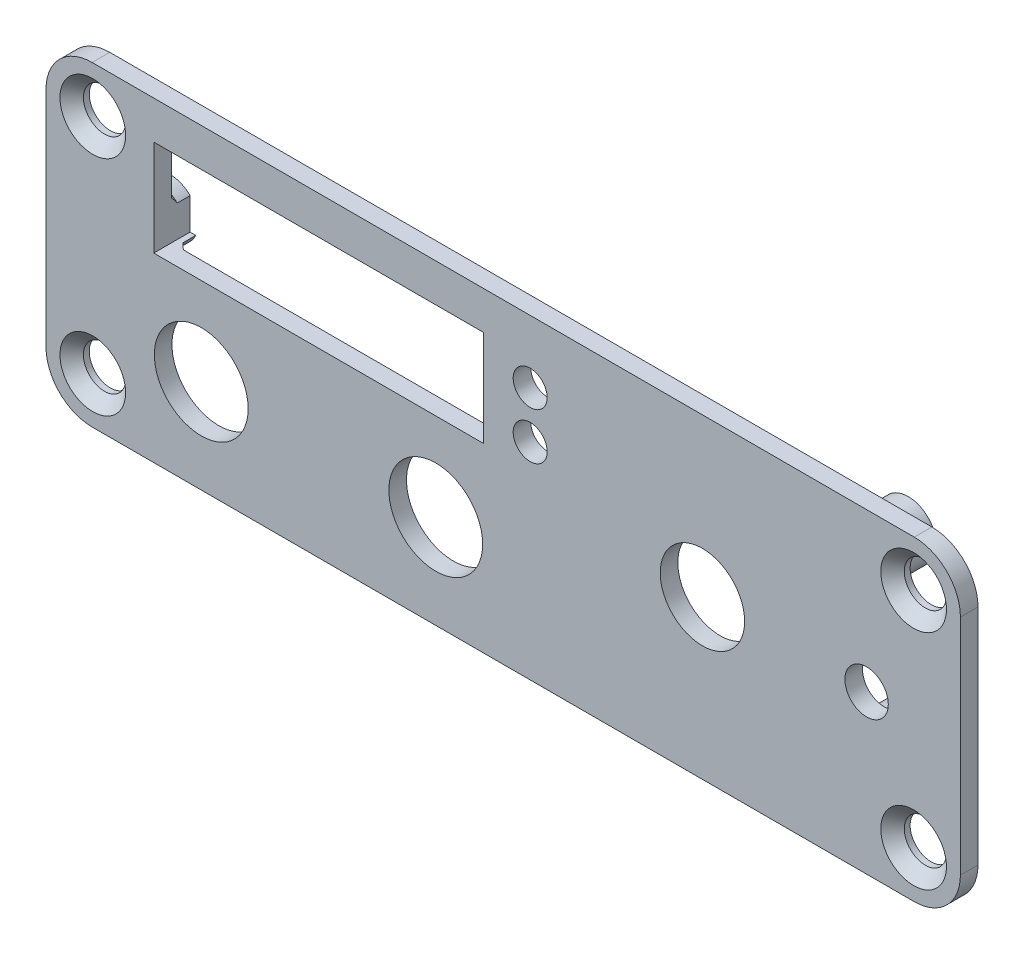
from build123d import *

# Parameters (mm, degrees)
SKETCH2_R           = 1.8
SKETCH2_R_2         = 3.6
SKETCH2_R_3         = 4
SKETCH2_R_4         = 1.45
SKETCH2_R_5         = 1.85
SKETCH2_W           = 28.1
SKETCH2_H           = 8.2
BOSS_EXTRUDE2_DEPTH = 1.5
SKETCH3_R           = 2.4
SKETCH3_R_2         = 0.9
BOSS_EXTRUDE3_DEPTH = 1.6
SKETCH4_R           = 2.4
SKETCH4_R_2         = 0.9
BOSS_EXTRUDE4_DEPTH = 4.8
CHAMFER1_SIZE       = 0.5
CHAMFER2_SIZE       = 1


with BuildPart() as part:
    # Sketch2 → Boss-Extrude2 (new body)
    with BuildSketch(Plane.XY):
        with BuildLine():
            Line((0, 22.989), (0, 3.935))
            ThreePointArc((0, 3.935), (1.152534816, 1.152534816), (3.935, 0))
            Line((3.935, 0), (74.043, 0))
            ThreePointArc((74.043, 0), (76.825465184, 1.152534816), (77.978, 3.935))
            Line((77.978, 3.935), (77.978, 22.989))
            ThreePointArc((77.978, 22.989), (76.825465184, 25.771465184), (74.043, 26.924))
            Line((74.043, 26.924), (3.935, 26.924))
            ThreePointArc((3.935, 26.924), (1.152534816, 25.771465184), (0, 22.989))
        make_face()
        with Locations((3.989, 22.962)):
            Circle(SKETCH2_R, mode=Mode.SUBTRACT)
        with Locations((73.989, 22.962)):
            Circle(SKETCH2_R, mode=Mode.SUBTRACT)
        with Locations((3.989, 3.962)):
            Circle(SKETCH2_R, mode=Mode.SUBTRACT)
        with Locations((73.989, 3.962)):
            Circle(SKETCH2_R, mode=Mode.SUBTRACT)
        with Locations((55.978, 13.462)):
            Circle(SKETCH2_R_2, mode=Mode.SUBTRACT)
        with Locations((13.239, 8)):
            Circle(SKETCH2_R_3, mode=Mode.SUBTRACT)
        with Locations((33.239, 8)):
            Circle(SKETCH2_R_3, mode=Mode.SUBTRACT)
        with Locations((41.289, 21.574)):
            Circle(SKETCH2_R_4, mode=Mode.SUBTRACT)
        with Locations((41.289, 17.574)):
            Circle(SKETCH2_R_4, mode=Mode.SUBTRACT)
        with Locations((69.978, 13.462)):
            Circle(SKETCH2_R_5, mode=Mode.SUBTRACT)
        with Locations((23.239, 19.574)):
            Rectangle(SKETCH2_W, SKETCH2_H, mode=Mode.SUBTRACT)
    extrude(amount=BOSS_EXTRUDE2_DEPTH)

    # Sketch3 → Boss-Extrude3 (add)
    # profile 1 of 2: a face of its own
    with BuildSketch(Plane(origin=(0, 0, 0), x_dir=(-1, 0, 0), z_dir=(0, 0, -1))):
        with Locations((-46.239, 22.674)):
            Circle(SKETCH3_R)
        with Locations((-46.239, 22.674)):
            Circle(SKETCH3_R_2, mode=Mode.SUBTRACT)
    # profile 2 of 2: a face of its own
    with BuildSketch(Plane(origin=(0, 0, 0), x_dir=(-1, 0, 0), z_dir=(0, 0, -1))):
        with BuildLine():
            Line((-9.189, 15.474), (-9.670742423, 15.474))
            ThreePointArc((-9.670742423, 15.474), (-5.126472799, 16.051548555), (-9.189, 18.168107435))
            Line((-9.189, 18.168107435), (-9.189, 15.474))
        make_face()
        with Locations((-7.489, 16.474)):
            Circle(SKETCH3_R_2, mode=Mode.SUBTRACT)
    extrude(amount=BOSS_EXTRUDE3_DEPTH)

    # Sketch4 → Boss-Extrude4 (add)
    # profile 1 of 3: a face of its own
    with BuildSketch(Plane(origin=(0, 0, 0), x_dir=(-1, 0, 0), z_dir=(0, 0, -1))):
        with Locations((-67.228, 20.962)):
            Circle(SKETCH4_R)
        with Locations((-67.228, 20.962)):
            Circle(SKETCH4_R_2, mode=Mode.SUBTRACT)
    # profile 2 of 3: a face of its own
    with BuildSketch(Plane(origin=(0, 0, 0), x_dir=(-1, 0, 0), z_dir=(0, 0, -1))):
        with Locations((-67.228, 5.962)):
            Circle(SKETCH4_R)
        with Locations((-67.228, 5.962)):
            Circle(SKETCH4_R_2, mode=Mode.SUBTRACT)
    # profile 3 of 3: a face of its own
    with BuildSketch(Plane(origin=(0, 0, 0), x_dir=(-1, 0, 0), z_dir=(0, 0, -1))):
        with Locations((-45.728, 5.962)):
            Circle(SKETCH4_R)
        with Locations((-45.728, 5.962)):
            Circle(SKETCH4_R_2, mode=Mode.SUBTRACT)
    extrude(amount=BOSS_EXTRUDE4_DEPTH)

    # Chamfer1
    chamfer1_edges = [part.edges().sort_by_distance(p)[0] for p in [
        (5.126472799, 16.051548555, 0),
        (48.639, 22.674, 0),
        (48.128, 5.962, 0),
        (69.628, 20.962, 0),
        (69.628, 5.962, 0),
    ]]
    chamfer(chamfer1_edges, length=CHAMFER1_SIZE)

    # Chamfer2
    chamfer2_edges = [part.edges().sort_by_distance(p)[0] for p in [
        (72.189, 3.962, 1.5),
        (72.189, 22.962, 1.5),
        (2.189, 22.962, 1.5),
        (2.189, 3.962, 1.5),
    ]]
    chamfer(chamfer2_edges, length=CHAMFER2_SIZE)


solid = part.part
